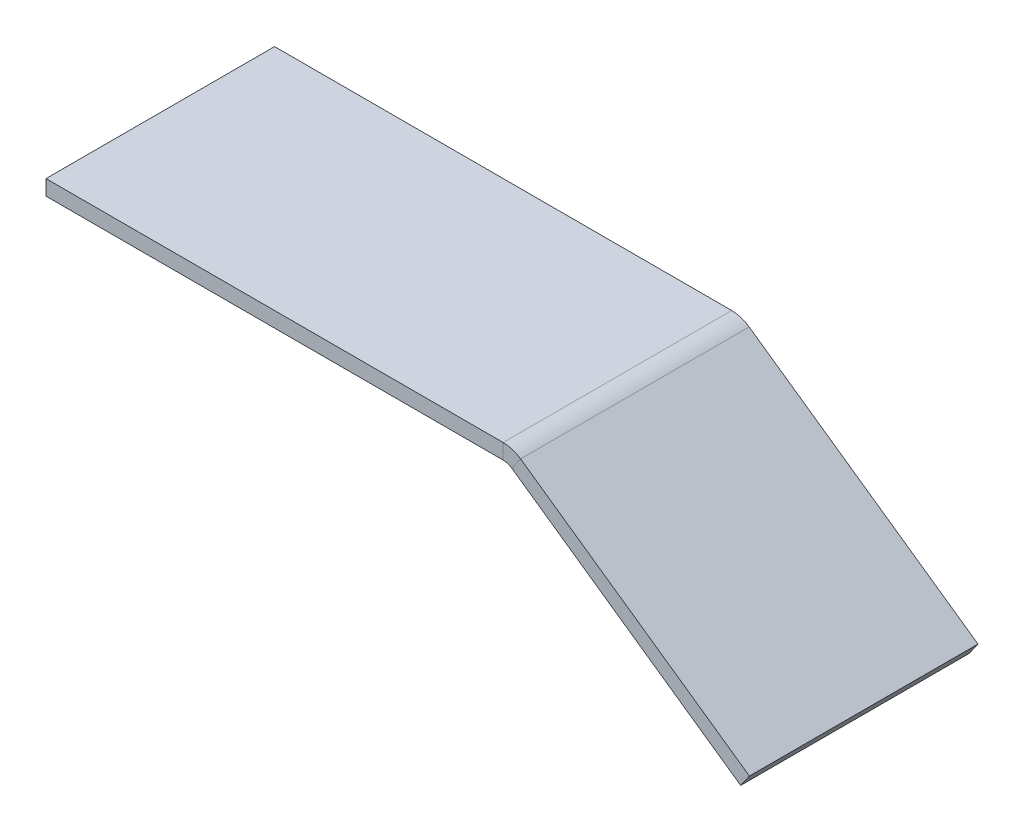
from build123d import *

# Parameters (mm, degrees)
SM_BASE_FLANGE_1_DEPTH = 60
CUT_EXTRUDE_1_DEPTH    = 306.076680355


# Sheet-metal steps are written as plain solids
with BuildPart() as part:
    # Sketch 1 → 基体-法兰1 (new, symmetric)
    with BuildSketch(Plane.XY):
        with BuildLine():
            Line((-245, 0), (-5.044780622, 0))
            ThreePointArc((-5.044780622, 0), (-0.23348783, -0.740528788), (4.13244236, -2.893567291))
            Line((4.13244236, -2.893567291), (185.659240876, -130))
            Line((185.659240876, -130), (181.070629386, -136.553216354))
            Line((181.070629386, -136.553216354), (-0.456169131, -9.446783646))
            ThreePointArc((-0.456169131, -9.446783646), (-2.639134226, -8.370264394), (-5.044780622, -8))
            Line((-5.044780622, -8), (-245, -8))
            Line((-245, -8), (-245, 0))
        make_face()
    extrude(amount=SM_BASE_FLANGE_1_DEPTH, both=True)

    # 草图6 → 切除-拉伸1 (cut, through all)
    with BuildSketch(Plane.XY.offset(60)):
        Polygon((124.248876587, -87), (119.660265096, -93.553216354), (181.070629386, -136.553216354), (185.659240876, -130), align=None)
    extrude(amount=-CUT_EXTRUDE_1_DEPTH, mode=Mode.SUBTRACT)


solid = part.part
